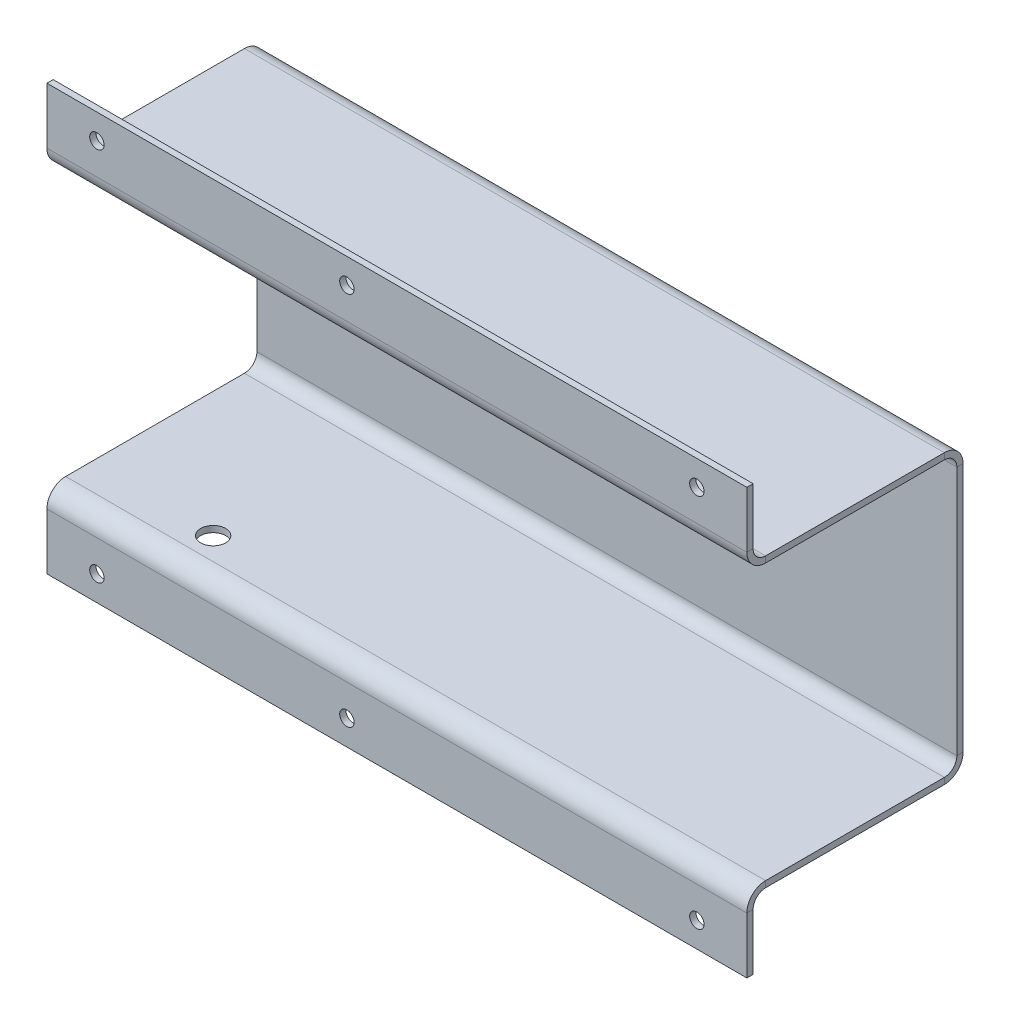
from build123d import *

# Parameters (mm, degrees)
BASE_FLANGE1_DEPTH          = 88.9
F_27_0_144_DIAMETER_HOLE1_D = 3.6576
F_1_4_0_25_DIAMETER_HOLE1_D = 6.35


# Sheet-metal steps are written as plain solids
with BuildPart() as part:
    # Sketch1 → Base-Flange1 (new, symmetric)
    with BuildSketch(Plane.YZ):
        with BuildLine():
            Line((-53.975, 26.67), (-39.6875, 26.67))
            ThreePointArc((-39.6875, 26.67), (-36.319903955, 25.275096045), (-34.925, 21.9075))
            Line((-34.925, 21.9075), (-34.925, -23.495))
            ThreePointArc((-34.925, -23.495), (-33.99506403, -25.74006403), (-31.75, -26.67))
            Line((-31.75, -26.67), (31.75, -26.67))
            ThreePointArc((31.75, -26.67), (33.99506403, -25.74006403), (34.925, -23.495))
            Line((34.925, -23.495), (34.925, 21.9075))
            ThreePointArc((34.925, 21.9075), (36.319903955, 25.275096045), (39.6875, 26.67))
            Line((39.6875, 26.67), (53.975, 26.67))
            Line((53.975, 26.67), (53.975, 25.0825))
            Line((53.975, 25.0825), (39.6875, 25.0825))
            ThreePointArc((39.6875, 25.0825), (37.44243597, 24.15256403), (36.5125, 21.9075))
            Line((36.5125, 21.9075), (36.5125, -23.495))
            ThreePointArc((36.5125, -23.495), (35.117596045, -26.862596045), (31.75, -28.2575))
            Line((31.75, -28.2575), (-31.75, -28.2575))
            ThreePointArc((-31.75, -28.2575), (-35.117596045, -26.862596045), (-36.5125, -23.495))
            Line((-36.5125, -23.495), (-36.5125, 21.9075))
            ThreePointArc((-36.5125, 21.9075), (-37.44243597, 24.15256403), (-39.6875, 25.0825))
            Line((-39.6875, 25.0825), (-53.975, 25.0825))
            Line((-53.975, 25.0825), (-53.975, 26.67))
        make_face()
    extrude(amount=BASE_FLANGE1_DEPTH, both=True)

    # #27 (0.144) Diameter Hole1 (through all)
    with Locations(Plane.XY.offset(26.67)):
        with Locations((-76.2, 47.625), (-12.7, 47.625), (76.2, 47.625), (76.2, -47.625), (-12.7, -47.625), (-76.2, -47.625)):
            Hole(F_27_0_144_DIAMETER_HOLE1_D / 2)

    # 1/4 (0.25) Diameter Hole1 (through all)
    with Locations(Plane.XZ.offset(36.5125)):
        with Locations((-57.15, 16.1925)):
            Hole(F_1_4_0_25_DIAMETER_HOLE1_D / 2)


solid = part.part
